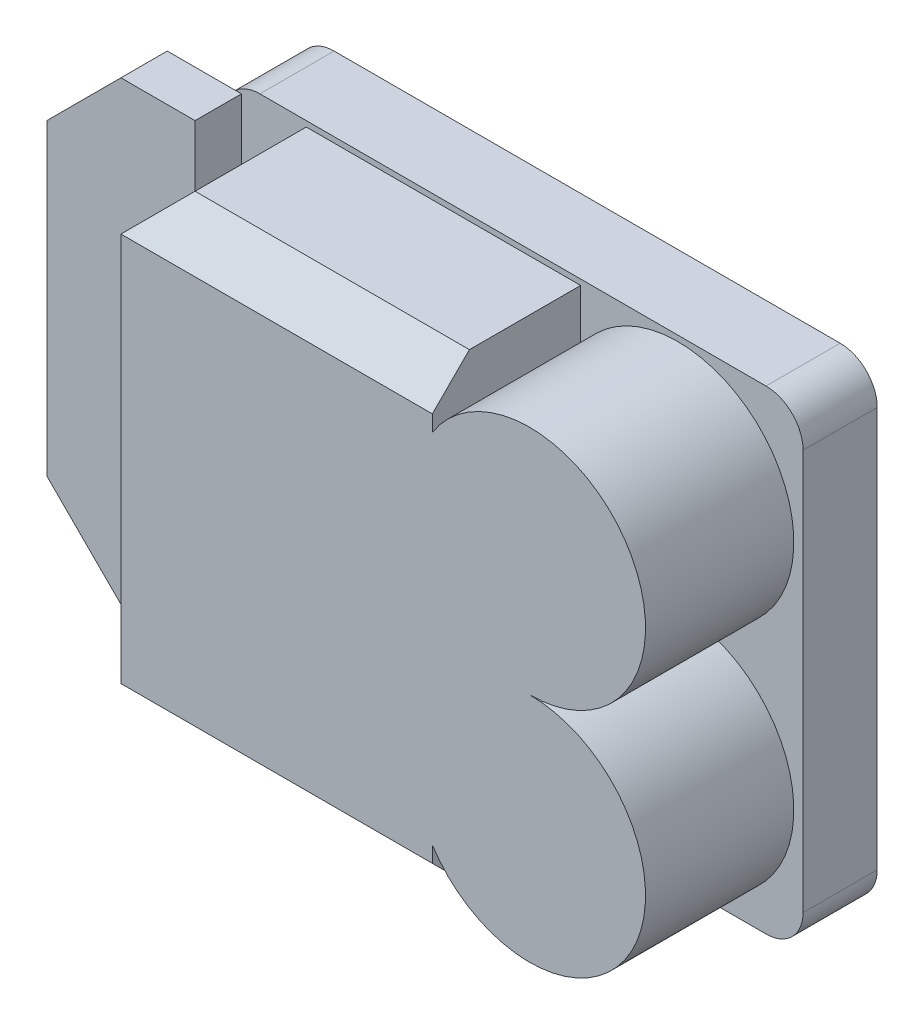
from build123d import *

# Parameters (mm, degrees)
SKETCH_1_W            = 1
SKETCH_1_H            = 2
EXTRUDE_1_DEPTH       = 8
SKETCH_2_W            = 31.3
SKETCH_2_H            = 25.6
EXTRUDE_12_DEPTH      = 4
EXTRUDE_13_DEPTH      = 7
EXTRUDE_13_DEPTH_BACK = 1
SKETCH_3_W            = 2.5
SKETCH_3_H            = 24.6
CHAMFER_1_SIZE        = 4
FILLET_1_R            = 2
CHAMFER_2_SIZE        = 2


with BuildPart() as part:
    # 草图1 → 凸台-拉伸1 (new body)
    with BuildSketch(Plane.XY):
        Polygon((0, 25), (0, 0), (15.8, 0), (15.8, 6.250000037), (15.8, 11.5), (15.8, 13.5), (15.8, 18.749999979), (15.8, 25), align=None)
        with BuildLine():
            Line((16.8, 25), (15.8, 25))
            Line((15.8, 25), (15.8, 18.749999979))
            ThreePointArc((15.8, 18.749999979), (16.055210593, 20.517766943), (16.8, 22.141164992))
            Line((16.8, 22.141164992), (16.8, 25))
        make_face()
        with BuildLine():
            ThreePointArc((16.8, 22.141164992), (16.055210593, 20.517766943), (15.8, 18.749999979))
            ThreePointArc((15.8, 18.749999979), (16.055210599, 16.982233037), (16.8, 15.358835008))
            Line((16.8, 15.358835008), (16.8, 22.141164992))
        make_face()
        with BuildLine():
            ThreePointArc((16.8, 15.358835008), (16.055210599, 16.982233037), (15.8, 18.749999979))
            Line((15.8, 18.749999979), (15.8, 13.5))
            Line((15.8, 13.5), (16.8, 13.5))
            Line((16.8, 13.5), (16.8, 15.358835008))
        make_face()
        with BuildLine():
            ThreePointArc((28.3, 18.75), (26.469417382, 23.169417382), (22.05, 25))
            ThreePointArc((22.05, 25), (19.061043761, 24.238956239), (16.8, 22.141164992))
            Line((16.8, 22.141164992), (16.8, 15.358835008))
            ThreePointArc((16.8, 15.358835008), (17.630582618, 14.330582618), (18.658835008, 13.5))
            Line((18.658835008, 13.5), (25.441164992, 13.5))
            ThreePointArc((25.441164992, 13.5), (27.538956239, 15.761043761), (28.3, 18.75))
        make_face()
        with BuildLine():
            ThreePointArc((18.658835008, 13.5), (17.630582618, 14.330582618), (16.8, 15.358835008))
            Line((16.8, 15.358835008), (16.8, 13.5))
            Line((16.8, 13.5), (18.658835008, 13.5))
        make_face()
        with BuildLine():
            ThreePointArc((16.8, 2.858835008), (19.061043761, 0.761043761), (22.05, 0))
            ThreePointArc((22.05, 0), (26.469417382, 1.830582618), (28.3, 6.25))
            ThreePointArc((28.3, 6.25), (27.538956239, 9.238956239), (25.441164992, 11.5))
            Line((25.441164992, 11.5), (18.658835008, 11.5))
            ThreePointArc((18.658835008, 11.5), (17.630582618, 10.669417382), (16.8, 9.641164992))
            Line((16.8, 9.641164992), (16.8, 2.858835008))
        make_face()
        with BuildLine():
            Line((16.8, 11.5), (16.8, 9.641164992))
            ThreePointArc((16.8, 9.641164992), (17.630582618, 10.669417382), (18.658835008, 11.5))
            Line((18.658835008, 11.5), (16.8, 11.5))
        make_face()
        with BuildLine():
            Line((16.8, 13.5), (16.8, 11.5))
            Line((16.8, 11.5), (18.658835008, 11.5))
            ThreePointArc((18.658835008, 11.5), (20.282233047, 12.244789404), (22.05, 12.5))
            ThreePointArc((22.05, 12.5), (20.282233047, 12.755210596), (18.658835008, 13.5))
            Line((18.658835008, 13.5), (16.8, 13.5))
        make_face()
        with Locations((16.3, 12.5)):
            Rectangle(SKETCH_1_W, SKETCH_1_H)
        with BuildLine():
            ThreePointArc((16.8, 9.641164992), (16.055210601, 8.017766971), (15.8, 6.250000037))
            ThreePointArc((15.8, 6.250000037), (16.055210591, 4.482233065), (16.8, 2.858835008))
            Line((16.8, 2.858835008), (16.8, 9.641164992))
        make_face()
        with BuildLine():
            Line((15.8, 11.5), (15.8, 6.250000037))
            ThreePointArc((15.8, 6.250000037), (16.055210601, 8.017766971), (16.8, 9.641164992))
            Line((16.8, 9.641164992), (16.8, 11.5))
            Line((16.8, 11.5), (15.8, 11.5))
        make_face()
        with BuildLine():
            Line((15.8, 6.250000037), (15.8, 0))
            Line((15.8, 0), (16.8, 0))
            Line((16.8, 0), (16.8, 2.858835008))
            ThreePointArc((16.8, 2.858835008), (16.055210591, 4.482233065), (15.8, 6.250000037))
        make_face()
        with BuildLine():
            ThreePointArc((22.05, 12.5), (20.282233047, 12.244789404), (18.658835008, 11.5))
            Line((18.658835008, 11.5), (25.441164992, 11.5))
            ThreePointArc((25.441164992, 11.5), (23.817766953, 12.244789404), (22.05, 12.5))
        make_face()
        with BuildLine():
            ThreePointArc((18.658835008, 13.5), (20.282233047, 12.755210596), (22.05, 12.5))
            ThreePointArc((22.05, 12.5), (23.817766953, 12.755210596), (25.441164992, 13.5))
            Line((25.441164992, 13.5), (18.658835008, 13.5))
        make_face()
    extrude(amount=EXTRUDE_1_DEPTH)

    # 草图2 → 凸台-拉伸12 (add)
    with BuildSketch(Plane(origin=(0, 0, 0), x_dir=(-1, 0, 0), z_dir=(0, 0, -1))):
        with Locations((-13.15, 12.5)):
            Rectangle(SKETCH_2_W, SKETCH_2_H)
    extrude(amount=EXTRUDE_12_DEPTH)

    # 草图3 → 凸台-拉伸13 (add, two sides: drawn at the far end of the back side and taken through both)
    with BuildSketch(Plane.ZY.offset(2.5).offset(-EXTRUDE_13_DEPTH_BACK)):
        with Locations((1.25, 12.5)):
            Rectangle(SKETCH_3_W, SKETCH_3_H)
    extrude(amount=EXTRUDE_13_DEPTH + EXTRUDE_13_DEPTH_BACK)

    # 倒角1
    chamfer_1_edges = [part.edges().sort_by_distance(p)[0] for p in [
        (-9.5, 0.2, 1.25),
        (-9.5, 24.8, 1.25),
    ]]
    chamfer(chamfer_1_edges, length=CHAMFER_1_SIZE)

    # 圆角1
    # the kernel refuses this fillet: 2 mm, written as the material it takes off along each edge
    with BuildSketch(Plane(origin=(-2.5, -0.3, 0), x_dir=(0, 1, 0), z_dir=(0, 0, -1))) as fillet_1_piece_1:
        with BuildLine():
            CenterArc((FILLET_1_R, FILLET_1_R), FILLET_1_R, 180, 90)
            Line((0, FILLET_1_R), (0, 0))
            Line((0, 0), (FILLET_1_R, 0))
        make_face()
    extrude(amount=9, mode=Mode.SUBTRACT)
    with BuildSketch(Plane(origin=(-2.5, 25.3, 0), x_dir=(0, -1, 0), z_dir=(0, 0, -1))) as fillet_1_piece_2:
        with BuildLine():
            CenterArc((FILLET_1_R, -FILLET_1_R), FILLET_1_R, 90, 90)
            Line((0, -FILLET_1_R), (0, 0))
            Line((0, 0), (FILLET_1_R, 0))
        make_face()
    extrude(amount=9, mode=Mode.SUBTRACT)
    with BuildSketch(Plane(origin=(28.8, 25.3, 5), x_dir=(-1, 0, 0), z_dir=(0, 0, -1))) as fillet_1_piece_3:
        with BuildLine():
            CenterArc((FILLET_1_R, -FILLET_1_R), FILLET_1_R, 90, 90)
            Line((0, -FILLET_1_R), (0, 0))
            Line((0, 0), (FILLET_1_R, 0))
        make_face()
    extrude(amount=14, mode=Mode.SUBTRACT)
    with BuildSketch(Plane(origin=(28.8, -0.3, 5), x_dir=(-1, 0, 0), z_dir=(0, 0, -1))) as fillet_1_piece_4:
        with BuildLine():
            CenterArc((FILLET_1_R, FILLET_1_R), FILLET_1_R, 180, 90)
            Line((0, FILLET_1_R), (0, 0))
            Line((0, 0), (FILLET_1_R, 0))
        make_face()
    extrude(amount=14, mode=Mode.SUBTRACT)

    # 倒角2
    chamfer_2_edges = [part.edges().sort_by_distance(p)[0] for p in [
        (0, 0, 4),
        (0, 25, 4),
        (8.4, 25, 8),
        (8.4, 0, 8),
    ]]
    chamfer(chamfer_2_edges, length=CHAMFER_2_SIZE)


solid = part.part
